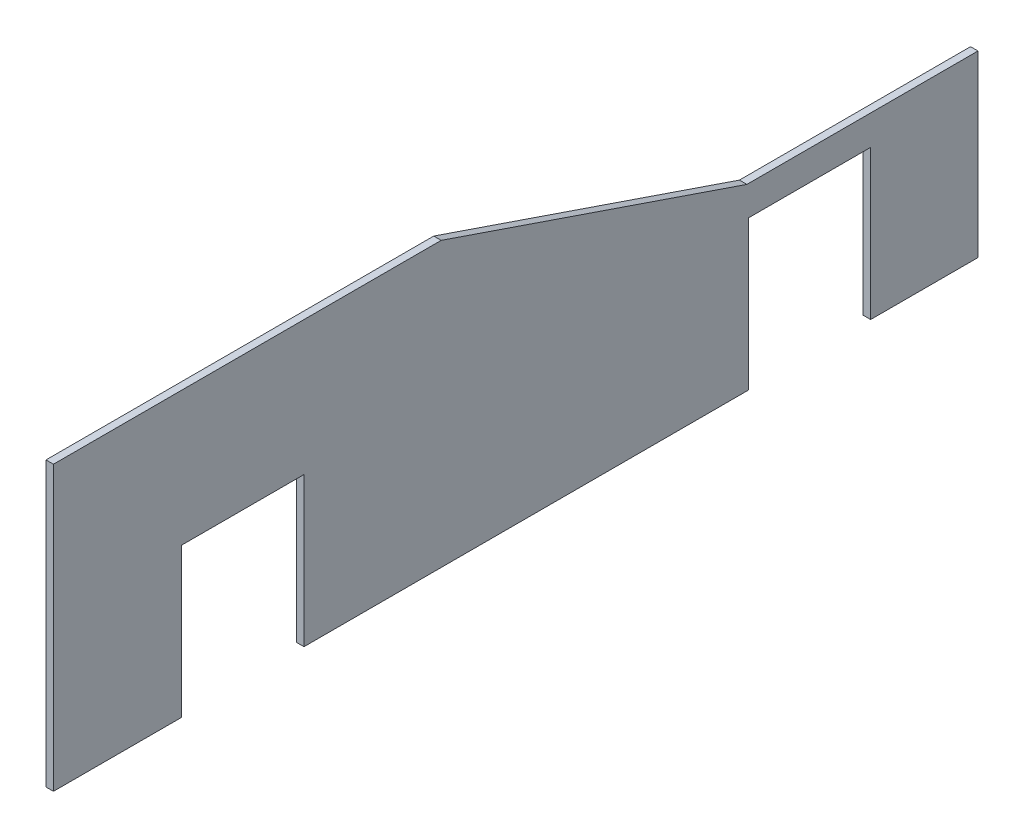
from build123d import *

# Parameters (mm, degrees)
SKETCH1_W           = 620
SKETCH1_H           = 190
BOSS_EXTRUDE1_DEPTH = 5
SKETCH2_W           = 82
SKETCH2_H           = 100
CUT_EXTRUDE1_DEPTH  = 5
BOSS_EXTRUDE2_DEPTH = 5


with BuildPart() as part:
    # Sketch1 → Boss-Extrude1 (new body)
    with BuildSketch(Plane(origin=(0, 0, 0), x_dir=(0, 0, -1), z_dir=(1, 0, 0))):
        Rectangle(SKETCH1_W, SKETCH1_H)
    extrude(amount=BOSS_EXTRUDE1_DEPTH)

    # Sketch2 → Cut-Extrude1 (cut)
    with BuildSketch(Plane(origin=(5, 0, 0), x_dir=(0, 0, -1), z_dir=(1, 0, 0))):
        with Locations((-183, -45)):
            Rectangle(SKETCH2_W, SKETCH2_H)
        with Locations((197, -45)):
            Rectangle(SKETCH2_W, SKETCH2_H)
        Polygon((-310, 95), (-310, 5), (-190, 95), align=None)
        Polygon((310, 95), (-50, 95), (155, 25), (310, 25), align=None)
    extrude(amount=-CUT_EXTRUDE1_DEPTH, mode=Mode.SUBTRACT)

    # Sketch3 → Boss-Extrude2 (add)
    with BuildSketch(Plane(origin=(5, 0, 0), x_dir=(0, 0, -1), z_dir=(1, 0, 0))):
        Polygon((-190, 95), (-310, 95), (-310, 5), align=None)
    extrude(amount=-BOSS_EXTRUDE2_DEPTH)


solid = part.part
